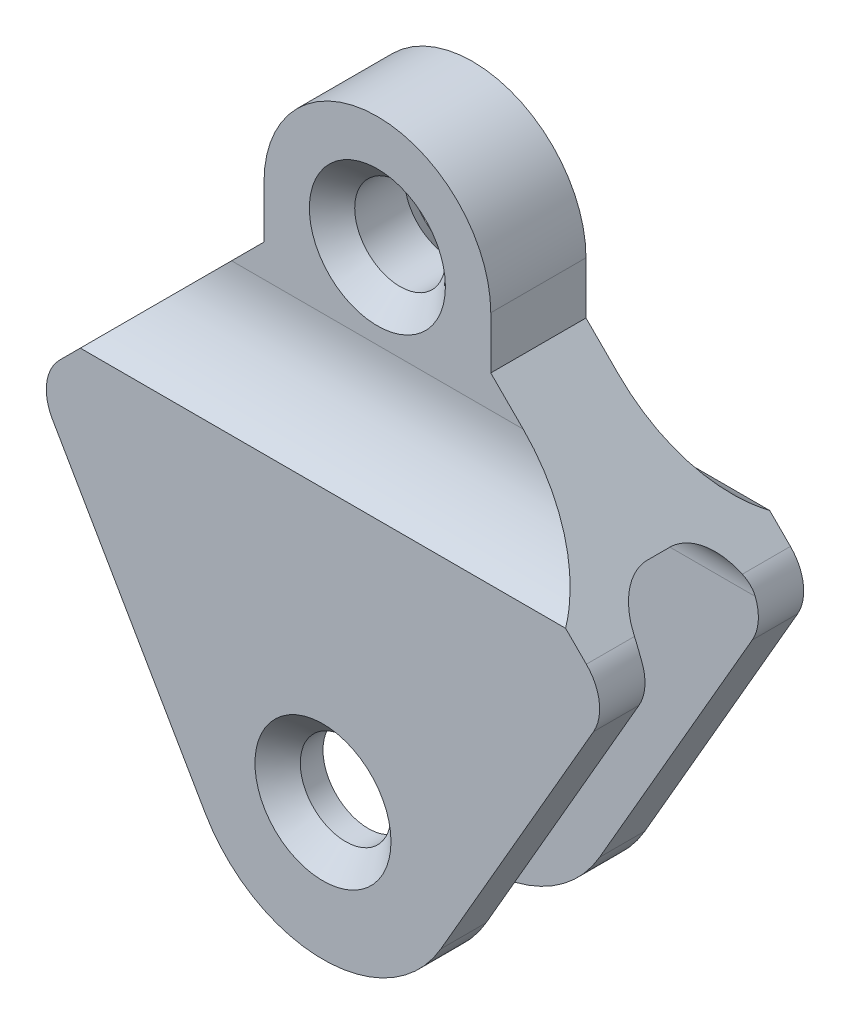
from build123d import *

# Parameters (mm, degrees)
SKETCH2_R           = 10
BOSS_EXTRUDE2_DEPTH = 22.5
CUT_EXTRUDE4_START  = -12
CUT_EXTRUDE4_DEPTH  = 12
FILLET7_R           = 25
CUT_EXTRUDE5_DEPTH  = 12.5
FILLET8_R           = 10
FILLET9_R           = 10
CHAMFER5_SIZE       = 5


with BuildPart() as part:
    # Sketch2 → Boss-Extrude2 (new body)
    with BuildSketch(Plane.XY):
        with BuildLine():
            Line((-25, 0), (-25, -11.491470389))
            Line((-25, -11.491470389), (-63.508529611, -50))
            Line((-63.508529611, -50), (-25.980762114, -115))
            ThreePointArc((-25.980762114, -115), (0, -130), (25.980762114, -115))
            Line((25.980762114, -115), (63.508529611, -50))
            Line((63.508529611, -50), (25, -11.491470389))
            Line((25, -11.491470389), (25, 0))
            ThreePointArc((25, 0), (0, 25), (-25, 0))
        make_face()
        with Locations(Location((0, 0, 0), (0, 0, 180))):
            Circle(SKETCH2_R, mode=Mode.SUBTRACT)
        with Locations(Location((0, -100, 0), (0, 0, 180))):
            Circle(SKETCH2_R, mode=Mode.SUBTRACT)
    extrude(amount=BOSS_EXTRUDE2_DEPTH)

    # Sketch7 → Cut-Extrude4 (cut)
    with BuildSketch(Plane.XY.offset(22.5).offset(CUT_EXTRUDE4_START)):
        with BuildLine():
            Line((-25, -11.491470389), (-53.508529611, -40))
            Line((-53.508529611, -40), (53.508529611, -40))
            Line((53.508529611, -40), (25, -11.491470389))
            Line((25, -11.491470389), (25, 0))
            ThreePointArc((25, 0), (0, 25), (-25, 0))
            Line((-25, 0), (-25, -11.491470389))
        make_face()
    extrude(amount=CUT_EXTRUDE4_DEPTH, mode=Mode.SUBTRACT)

    # Fillet7
    # the kernel refuses this fillet: 25 mm, written as the material it adds along each edge
    with BuildSketch(Plane(origin=(-106.893920871, -40, 10.5), x_dir=(0, 1, 0), z_dir=(1, 0, 0))) as fillet7_piece_1_section:
        with BuildLine():
            CenterArc((21.354156504, 25), FILLET7_R, 211.332251498, 58.667748502)
            Line((0, 12), (-0.42708313, 11.74))
            ThreePointArc((-0.42708313, 11.74), (-0.5, 6), (-0.5, 0))
            Line((-0.5, 0), (0, -0.5))
            Line((0, -0.5), (21.354156504, -0.5))
            Line((21.354156504, -0.5), (21.354156504, 0))
        make_face()
    fillet7_piece_1 = extrude(amount=213.787841742, mode=Mode.PRIVATE)
    fillet7_piece_1 = split(fillet7_piece_1, bisect_by=Plane(origin=(-24.314247143, -10.805717532, 13.775046533), z_dir=(0.7071067811865464, -0.7071067811865488, 0)), keep=Keep.TOP, mode=Mode.PRIVATE)
    fillet7_piece_1 = split(fillet7_piece_1, bisect_by=Plane(origin=(24.314247143, -10.805717532, 13.775046533), z_dir=(-0.7071067811865461, -0.7071067811865489, 0)), keep=Keep.TOP, mode=Mode.PRIVATE)
    add(fillet7_piece_1)

    # Sketch8 → Cut-Extrude5 (cut)
    with BuildSketch(Plane(origin=(0, 0, 0), x_dir=(-1, 0, 0), z_dir=(0, 0, -1))):
        with BuildLine():
            Line((-51.508529611, -38), (51.508529611, -38))
            Line((51.508529611, -38), (63.508529611, -50))
            Line((63.508529611, -50), (25.980762114, -115))
            ThreePointArc((25.980762114, -115), (0, -130), (-25.980762114, -115))
            Line((-25.980762114, -115), (-63.508529611, -50))
            Line((-63.508529611, -50), (-51.508529611, -38))
        make_face()
    extrude(amount=-CUT_EXTRUDE5_DEPTH, mode=Mode.SUBTRACT)

    # Fillet8
    fillet8_edges = [part.edges().sort_by_distance(p)[0] for p in [
        (0, -38, 12.5),
    ]]
    fillet(fillet8_edges, radius=FILLET8_R)

    # Fillet9
    fillet9_edges = [part.edges().sort_by_distance(p)[0] for p in [
        (-63.508529611, -50, 17.5),
        (63.508529611, -50, 17.5),
    ]]
    fillet(fillet9_edges, radius=FILLET9_R)

    # Chamfer5
    chamfer5_edges = [part.edges().sort_by_distance(p)[0] for p in [
        (10, -100, 22.5),
        (10, 0, 10.5),
    ]]
    chamfer(chamfer5_edges, length=CHAMFER5_SIZE)

    # Mirror3: part across plane


with BuildPart() as part_1:
    add(part.part)
    add(part.part.mirror(Plane(origin=(0, -100, 0), x_dir=(1, 0, 0), z_dir=(0, 0, 1))))


solid = part_1.part
